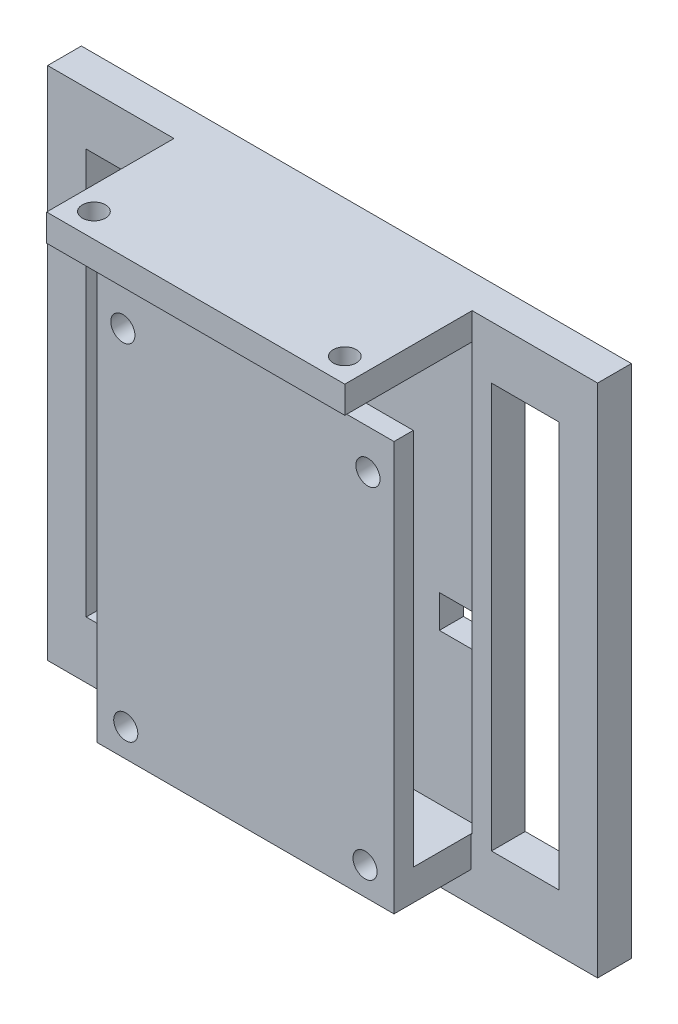
from build123d import *
from build123d.topology import SkipClean

# Parameters (mm, degrees)
SKETCH_1_W            = 57
SKETCH_1_H            = 51
SKETCH_1_W_2          = 3.4
SKETCH_1_H_2          = 3.4
SKETCH_1_W_3          = 7
SKETCH_1_H_3          = 42
EXTRUDE_1_DEPTH       = 3
SKETCH_2_W            = 31
SKETCH_2_H            = 47
CUT_EXTRUDE_1_DEPTH   = 1
SKETCH_5_W            = 57
SKETCH_5_H            = 3
EXTRUDE_2_DEPTH       = 1
SKETCH_6_W            = 57
SKETCH_6_H            = 3
EXTRUDE_3_DEPTH       = 1
SKETCH_7_W            = 10
SKETCH_7_H            = 3
EXTRUDE_4_DEPTH       = 6
SKETCH_8_W            = 31
SKETCH_8_H            = 3
EXTRUDE_5_DEPTH       = 6
CUT_EXTRUDE_3_REACH   = 63.082
SKETCH_9_R            = 1.15
EXTRUDE_6_OUTLINE_W   = 57
EXTRUDE_6_OUTLINE_H   = 53
EXTRUDE_6_OUTLINE_W_2 = 3.4
EXTRUDE_6_OUTLINE_H_2 = 3.4
EXTRUDE_6_OUTLINE_W_3 = 7
EXTRUDE_6_OUTLINE_H_3 = 42
EXTRUDE_6_DEPTH       = 0.5
EXTRUDE_7_DEPTH       = 0.2
EXTRUDE_START         = 0.2
SKETCH_14_R           = 1.15
EXTRUDE_8_DEPTH       = 0.2
CUT_EXTRUDE_START     = -0.2
SKETCH_15_R           = 1.15
CUT_EXTRUDE_5_DEPTH   = 0.2
CUT_EXTRUDE_6_DEPTH   = 0.2
SKETCH_17_W           = 31
SKETCH_17_H           = 3
EXTRUDE_9_DEPTH       = 5
SKETCH_18_W           = 31
SKETCH_18_H           = 2
EXTRUDE_10_DEPTH      = 50.4
SKETCH_3_R            = 1.25
CUT_EXTRUDE_7_DEPTH   = 9
EXTRUDE_START_2       = -0.2
EXTRUDE_11_OUTLINE_R  = 1.15
EXTRUDE_11_DEPTH      = 3.2
SKETCH_22_W           = 31
SKETCH_22_H           = 6
CUT_EXTRUDE_10_DEPTH  = 3
SKETCH_17_2_W         = 31
SKETCH_17_2_H         = 3
EXTRUDE_12_DEPTH      = 7.2
SKETCH_24_W           = 31
SKETCH_24_H           = 2
CUT_EXTRUDE_11_DEPTH  = 3
SKETCH_25_R           = 1.2
CUT_EXTRUDE_12_DEPTH  = 3
SKETCH_27_W           = 11
SKETCH_27_H           = 3.2
EXTRUDE_13_DEPTH      = 6
CUT_EXTRUDE_13_REACH  = 45.42
SKETCH_28_W           = 5
SKETCH_28_H           = 5
SKETCH_31_W           = 64.96263637
SKETCH_31_H           = 23.079945777
CUT_EXTRUDE_14_DEPTH  = 0.2
SKETCH_32_W           = 57
SKETCH_32_H           = 3.5
EXTRUDE_14_DEPTH      = 0.2
CUT_EXTRUDE_15_DEPTH  = 0.1
CUT_EXTRUDE_16_DEPTH  = 0.1


# Read off the part's stored shape, not the designer's step: 凸台-拉伸6, 凸台-拉伸11
with BuildPart() as part:
    # 草图1 → 凸台-拉伸1 (new body)
    with BuildSketch(Plane.XY):
        with Locations((0.5, 3.5)):
            Rectangle(SKETCH_1_W, SKETCH_1_H)
        with Locations((13.3, 0.3)):
            Rectangle(SKETCH_1_W_2, SKETCH_1_H_2, mode=Mode.SUBTRACT)
        with Locations((21.5, 3.5)):
            Rectangle(SKETCH_1_W_3, SKETCH_1_H_3, mode=Mode.SUBTRACT)
        with Locations((-20.5, 3.5)):
            Rectangle(SKETCH_1_W_3, SKETCH_1_H_3, mode=Mode.SUBTRACT)
    extrude(amount=EXTRUDE_1_DEPTH)

    # 草图2 → 切除-拉伸1 (cut)
    with BuildSketch(Plane.XY.offset(3)):
        with Locations((0.5, 3.5)):
            Rectangle(SKETCH_2_W, SKETCH_2_H)
    extrude(amount=-CUT_EXTRUDE_1_DEPTH, mode=Mode.SUBTRACT)

    # 草图5 → 凸台-拉伸2 (add)
    with BuildSketch(Plane(origin=(0, 29, 0), x_dir=(1, 0, 0), z_dir=(0, 1, 0))):
        with Locations((0.5, -1.5)):
            Rectangle(SKETCH_5_W, SKETCH_5_H)
    extrude(amount=EXTRUDE_2_DEPTH)

    # 草图6 → 凸台-拉伸3 (add)
    with BuildSketch(Plane(origin=(0, -22, 0), x_dir=(-1, 0, 0), z_dir=(0, -1, 0))):
        with Locations((-0.5, -1.5)):
            Rectangle(SKETCH_6_W, SKETCH_6_H)
    extrude(amount=EXTRUDE_3_DEPTH)

    # 草图7 → 凸台-拉伸4 (add)
    with BuildSketch(Plane.XY.offset(3)):
        with Locations((-10, -21.5)):
            Rectangle(SKETCH_7_W, SKETCH_7_H)
        with Locations((11, -21.5)):
            Rectangle(SKETCH_7_W, SKETCH_7_H)
    extrude(amount=EXTRUDE_4_DEPTH)

    # 草图8 → 凸台-拉伸5 (add)
    with BuildSketch(Plane.XY.offset(3)):
        with Locations((0.5, 28.5)):
            Rectangle(SKETCH_8_W, SKETCH_8_H)
    extrude(amount=EXTRUDE_5_DEPTH)

    # 草图9 → 切除-拉伸3 (cut, up to next)
    with BuildSketch(Plane.XZ.offset(23), mode=Mode.PRIVATE) as cut_extrude_3_sk1:
        with Locations(Location((-10, 7, 0), (0, 0, 270))):
            Circle(SKETCH_9_R)
    cut_extrude_3_tool1 = extrude(cut_extrude_3_sk1.sketch, amount=-CUT_EXTRUDE_3_REACH, mode=Mode.PRIVATE) & part.part
    # 草图9 → 切除-拉伸3 (cut, up to next)
    with BuildSketch(Plane.XZ.offset(23), mode=Mode.PRIVATE) as cut_extrude_3_sk2:
        with Locations(Location((11, 7, 0), (0, 0, 270))):
            Circle(SKETCH_9_R)
    cut_extrude_3_tool2 = extrude(cut_extrude_3_sk2.sketch, amount=-CUT_EXTRUDE_3_REACH, mode=Mode.PRIVATE) & part.part
    add(cut_extrude_3_tool1.solids().sort_by_distance((-10, -23, 7))[0], mode=Mode.SUBTRACT)
    add(cut_extrude_3_tool2.solids().sort_by_distance((11, -23, 7))[0], mode=Mode.SUBTRACT)

    # 凸台-拉伸6 outline → 凸台-拉伸6 (add)
    with BuildSketch(Plane(origin=(0, 0, 0), x_dir=(-1, 0, 0), z_dir=(0, 0, -1))):
        with Locations((-0.5, 3.5)):
            Rectangle(EXTRUDE_6_OUTLINE_W, EXTRUDE_6_OUTLINE_H)
        with Locations((-13.3, 0.3)):
            Rectangle(EXTRUDE_6_OUTLINE_W_2, EXTRUDE_6_OUTLINE_H_2, mode=Mode.SUBTRACT)
        with Locations((-21.5, 3.5)):
            Rectangle(EXTRUDE_6_OUTLINE_W_3, EXTRUDE_6_OUTLINE_H_3, mode=Mode.SUBTRACT)
        with Locations((20.5, 3.5)):
            Rectangle(EXTRUDE_6_OUTLINE_W_3, EXTRUDE_6_OUTLINE_H_3, mode=Mode.SUBTRACT)
    extrude(amount=EXTRUDE_6_DEPTH)

    # 草图13 → 凸台-拉伸7 (add)
    with BuildSketch(Plane(origin=(0, 30, 0), x_dir=(1, 0, 0), z_dir=(0, 1, 0))):
        Polygon((16, -3), (29, -3), (29, 0.5), (-28, 0.5), (-28, -3), (-15, -3), (-15, -9), (16, -9), align=None)
    extrude(amount=EXTRUDE_7_DEPTH)

    # 草图14 → 凸台-拉伸8 (add)
    with BuildSketch(Plane(origin=(0, -23, 0), x_dir=(-1, 0, 0), z_dir=(0, -1, 0)).offset(EXTRUDE_START)):
        Polygon((-29, 0.5), (-29, -3), (-16, -3), (-16, -9), (-6, -9), (-6, -3), (5, -3), (5, -9), (15, -9), (15, -3), (28, -3), (28, 0.5), align=None)
        with Locations(Location((-11, -7, 0), (0, 0, 90))):
            Circle(SKETCH_14_R, mode=Mode.SUBTRACT)
        with Locations(Location((10, -7, 0), (0, 0, 90))):
            Circle(SKETCH_14_R, mode=Mode.SUBTRACT)
    extrude(amount=-EXTRUDE_8_DEPTH)

    # 草图15 → 切除-拉伸5 (cut)
    with BuildSketch(Plane(origin=(0, -20, 0), x_dir=(1, 0, 0), z_dir=(0, 1, 0)).offset(CUT_EXTRUDE_START)):
        Polygon((16, -2), (-15, -2), (-15, -3), (-15, -9), (-5, -9), (-5, -3), (6, -3), (6, -9), (16, -9), (16, -3), align=None)
        with Locations(Location((11, -7, 0), (0, 0, 90))):
            Circle(SKETCH_15_R, mode=Mode.SUBTRACT)
        with Locations(Location((-10, -7, 0), (0, 0, 90))):
            Circle(SKETCH_15_R, mode=Mode.SUBTRACT)
    extrude(amount=CUT_EXTRUDE_5_DEPTH, mode=Mode.SUBTRACT)

    # 草图16 → 切除-拉伸6 (cut)
    with BuildSketch(Plane.XZ.offset(-27)):
        Polygon((-15, 2), (16, 2), (16, 3), (16, 9), (-15, 9), (-15, 3), align=None)
    extrude(amount=-CUT_EXTRUDE_6_DEPTH, mode=Mode.SUBTRACT)

    # 草图17 → 凸台-拉伸9 (add)
    with BuildSketch(Plane.XY.offset(9)):
        with Locations((0.5, 28.7)):
            Rectangle(SKETCH_17_W, SKETCH_17_H)
    extrude(amount=EXTRUDE_9_DEPTH)

    # 草图18 → 凸台-拉伸10 (add)
    with BuildSketch(Plane.XZ.offset(-27.2)):
        with Locations((0.5, 10)):
            Rectangle(SKETCH_18_W, SKETCH_18_H)
    extrude(amount=EXTRUDE_10_DEPTH)

    # 草图3 → 切除-拉伸7 (cut)
    with BuildSketch(Plane.XY.offset(2)):
        with Locations(Location((-12.2, 18.3, 0), (0, 0, 180))):
            Circle(SKETCH_3_R)
        with Locations(Location((13.2, 18.1, 0), (0, 0, 180))):
            Circle(SKETCH_3_R)
        with Locations(Location((12.9, -17.3, 0), (0, 0, 180))):
            Circle(SKETCH_3_R)
        with Locations(Location((-11.9, -17.3, 0), (0, 0, 180))):
            Circle(SKETCH_3_R)
    extrude(amount=CUT_EXTRUDE_7_DEPTH, mode=Mode.SUBTRACT)

    # 凸台-拉伸11 outline → 凸台-拉伸11 (add)
    with SkipClean():  # the faces are left unmerged after this step: merging them gives an invalid solid
        with BuildSketch(Plane(origin=(0, -20, 0), x_dir=(1, 0, 0), z_dir=(0, 1, 0)).offset(EXTRUDE_START_2)):
            Polygon((-5, -9), (-5, -3), (6, -3), (6, -9), (16, -9), (16, -2), (-15, -2), (-15, -9), align=None)
            with Locations((-10, -7)):
                Circle(EXTRUDE_11_OUTLINE_R, mode=Mode.SUBTRACT)
            with Locations((11, -7)):
                Circle(EXTRUDE_11_OUTLINE_R, mode=Mode.SUBTRACT)
        extrude(amount=EXTRUDE_11_DEPTH)

    # 草图22 → 切除-拉伸10 (cut)
    with BuildSketch(Plane(origin=(0, -23.2, 0), x_dir=(-1, 0, 0), z_dir=(0, -1, 0))):
        with Locations((-0.5, -6)):
            Rectangle(SKETCH_22_W, SKETCH_22_H)
    extrude(amount=-CUT_EXTRUDE_10_DEPTH, mode=Mode.SUBTRACT)

    # 草图17<2> → 凸台-拉伸12 (add)
    with BuildSketch(Plane.XY.offset(9)):
        with Locations((0.5, 28.7)):
            Rectangle(SKETCH_17_2_W, SKETCH_17_2_H)
    extrude(amount=EXTRUDE_12_DEPTH)

    # 草图24 → 切除-拉伸11 (cut)
    with BuildSketch(Plane.XZ.offset(23.2)):
        with Locations((0.5, 10)):
            Rectangle(SKETCH_24_W, SKETCH_24_H)
    extrude(amount=-CUT_EXTRUDE_11_DEPTH, mode=Mode.SUBTRACT)

    # 草图25 → 切除-拉伸12 (cut)
    with BuildSketch(Plane.XZ.offset(-27.2)):
        with Locations(Location((-12.5, 13.7, 0), (0, 0, 270))):
            Circle(SKETCH_25_R)
        with Locations(Location((13.5, 13.7, 0), (0, 0, 270))):
            Circle(SKETCH_25_R)
    extrude(amount=-CUT_EXTRUDE_12_DEPTH, mode=Mode.SUBTRACT)

    # 草图27 → 凸台-拉伸13 (add)
    with BuildSketch(Plane.XY.offset(3)):
        with Locations((0.5, -18.6)):
            Rectangle(SKETCH_27_W, SKETCH_27_H)
    extrude(amount=EXTRUDE_13_DEPTH)

    # 草图28 → 切除-拉伸13 (cut, up to next)
    with BuildSketch(Plane.XY.offset(11), mode=Mode.PRIVATE) as cut_extrude_13_sk1:
        with Locations((13.5, 24.7)):
            Rectangle(SKETCH_28_W, SKETCH_28_H)
    cut_extrude_13_tool1 = extrude(cut_extrude_13_sk1.sketch, amount=-CUT_EXTRUDE_13_REACH, mode=Mode.PRIVATE) & part.part
    add(cut_extrude_13_tool1.solids().sort_by_distance((13.5, 24.7, 11))[0], mode=Mode.SUBTRACT)

    # 草图31 → 切除-拉伸14 (cut)
    with BuildSketch(Plane(origin=(0, 30.2, 0), x_dir=(1, 0, 0), z_dir=(0, 1, 0))):
        with Locations((-0.558713109, -6.113710501)):
            Rectangle(SKETCH_31_W, SKETCH_31_H)
    extrude(amount=-CUT_EXTRUDE_14_DEPTH, mode=Mode.SUBTRACT)

    # 草图32 → 凸台-拉伸14 (add)
    with BuildSketch(Plane.XZ.offset(23.2)):
        with Locations((0.5, 1.25)):
            Rectangle(SKETCH_32_W, SKETCH_32_H)
    extrude(amount=EXTRUDE_14_DEPTH)

    # 草图33 → 切除-拉伸15 (cut)
    with BuildSketch(Plane.ZY.offset(15)):
        Polygon((16.2, 27.2), (16.2, 30), (3, 30), (3, 27.2), (9, 27.2), (9, -17), (3, -17), (3, -20.2), (11, -20.2), (11, 27.2), align=None)
    extrude(amount=-CUT_EXTRUDE_15_DEPTH, mode=Mode.SUBTRACT)

    # 草图34 → 切除-拉伸16 (cut)
    with BuildSketch(Plane(origin=(16, 0, 0), x_dir=(0, 0, -1), z_dir=(1, 0, 0))):
        Polygon((-3, -17), (-9, -17), (-9, 22.2), (-11, 22.2), (-11, -20.2), (-3, -20.2), align=None)
    extrude(amount=-CUT_EXTRUDE_16_DEPTH, mode=Mode.SUBTRACT)


solid = part.part
